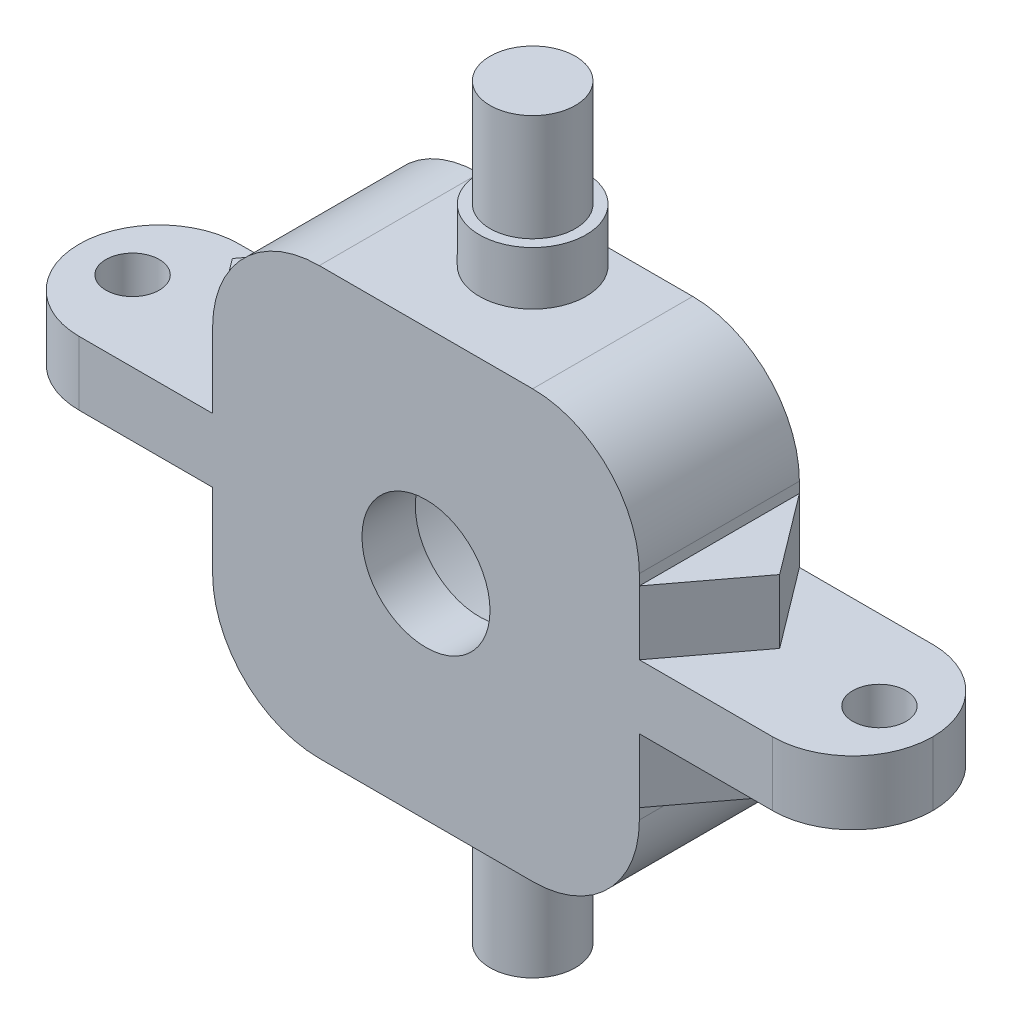
from build123d import *

# Parameters (mm, degrees)
SKETCH1_W           = 40
SKETCH1_H           = 40
SKETCH1_R           = 6
BOSS_EXTRUDE1_DEPTH = 15
SKETCH2_R           = 15
CUT_EXTRUDE1_DEPTH  = 10
SKETCH4_R           = 4
BOSS_EXTRUDE2_DEPTH = 15
SKETCH5_R           = 5
BOSS_EXTRUDE3_DEPTH = 5
BOSS_EXTRUDE4_START = 5
SKETCH7_R           = 5
BOSS_EXTRUDE4_DEPTH = 5
BOSS_EXTRUDE5_START = 10
SKETCH8_R           = 4
BOSS_EXTRUDE5_DEPTH = 10
FILLET1_R           = 10
SKETCH9_W           = 15
SKETCH9_H           = 6
BOSS_EXTRUDE6_DEPTH = 20
SKETCH10_W          = 15
SKETCH10_H          = 6
BOSS_EXTRUDE7_DEPTH = 20
CUT_EXTRUDE2_REACH  = 74.588
SKETCH11_R          = 2.5
FILLET2_R           = 7.5
BOSS_EXTRUDE8_DEPTH = 6
BOSS_EXTRUDE9_DEPTH = 6


with BuildPart() as part:
    # Sketch1 → Boss-Extrude1 (new body)
    with BuildSketch(Plane.XY):
        with Locations((20, 20)):
            Rectangle(SKETCH1_W, SKETCH1_H)
        with Locations((20, 20)):
            Circle(SKETCH1_R, mode=Mode.SUBTRACT)
    extrude(amount=BOSS_EXTRUDE1_DEPTH)

    # Sketch2 → Cut-Extrude1 (cut)
    with BuildSketch(Plane(origin=(0, 0, 0), x_dir=(-1, 0, 0), z_dir=(0, 0, -1))):
        with Locations((-20, 20)):
            Circle(SKETCH2_R)
    extrude(amount=-CUT_EXTRUDE1_DEPTH, mode=Mode.SUBTRACT)

    # Sketch4 → Boss-Extrude2 (add)
    with BuildSketch(Plane(origin=(0, 40, 0), x_dir=(1, 0, 0), z_dir=(0, 1, 0))):
        with Locations((20, -5)):
            Circle(SKETCH4_R)
    extrude(amount=BOSS_EXTRUDE2_DEPTH)

    # Sketch5 → Boss-Extrude3 (add)
    with BuildSketch(Plane(origin=(0, 40, 0), x_dir=(1, 0, 0), z_dir=(0, 1, 0))):
        with Locations(Location((20, -5, 0), (0, 0, 90))):
            Circle(SKETCH5_R)
    extrude(amount=BOSS_EXTRUDE3_DEPTH)

    # Sketch7 → Boss-Extrude4 (add)
    with BuildSketch(Plane.XZ.offset(BOSS_EXTRUDE4_START)):
        with Locations(Location((20, 5, 0), (0, 0, 270))):
            Circle(SKETCH7_R)
    extrude(amount=-BOSS_EXTRUDE4_DEPTH)

    # Sketch8 → Boss-Extrude5 (add)
    with BuildSketch(Plane.XZ.offset(5).offset(BOSS_EXTRUDE5_START)):
        with Locations(Location((20, 5, 0), (0, 0, 180))):
            Circle(SKETCH8_R)
    extrude(amount=-BOSS_EXTRUDE5_DEPTH)

    # Fillet1
    fillet1_edges = [part.edges().sort_by_distance(p)[0] for p in [
        (40, 0, 7.5),
        (0, 0, 7.5),
        (0, 40, 7.5),
        (40, 40, 7.5),
    ]]
    fillet(fillet1_edges, radius=FILLET1_R)

    # Sketch9 → Boss-Extrude6 (add)
    with BuildSketch(Plane(origin=(40, 0, 0), x_dir=(0, 0, -1), z_dir=(1, 0, 0))):
        with Locations((-7.5, 20)):
            Rectangle(SKETCH9_W, SKETCH9_H)
    extrude(amount=BOSS_EXTRUDE6_DEPTH)

    # Sketch10 → Boss-Extrude7 (add)
    with BuildSketch(Plane.ZY):
        with Locations((7.5, 20)):
            Rectangle(SKETCH10_W, SKETCH10_H)
    extrude(amount=BOSS_EXTRUDE7_DEPTH)

    # Sketch11 → Cut-Extrude2 (cut, up to next)
    with BuildSketch(Plane(origin=(0, 23, 0), x_dir=(1, 0, 0), z_dir=(0, 1, 0)), mode=Mode.PRIVATE) as cut_extrude2_sk1:
        with Locations(Location((-15, -7.5, 0), (0, 0, 270))):
            Circle(SKETCH11_R)
    cut_extrude2_tool1 = extrude(cut_extrude2_sk1.sketch, amount=-CUT_EXTRUDE2_REACH, mode=Mode.PRIVATE) & part.part
    # Sketch11 → Cut-Extrude2 (cut, up to next)
    with BuildSketch(Plane(origin=(0, 23, 0), x_dir=(1, 0, 0), z_dir=(0, 1, 0)), mode=Mode.PRIVATE) as cut_extrude2_sk2:
        with Locations(Location((55, -7.5, 0), (0, 0, 270))):
            Circle(SKETCH11_R)
    cut_extrude2_tool2 = extrude(cut_extrude2_sk2.sketch, amount=-CUT_EXTRUDE2_REACH, mode=Mode.PRIVATE) & part.part
    add(cut_extrude2_tool1.solids().sort_by_distance((-15, 23, 7.5))[0], mode=Mode.SUBTRACT)
    add(cut_extrude2_tool2.solids().sort_by_distance((55, 23, 7.5))[0], mode=Mode.SUBTRACT)

    # Fillet2
    fillet2_edges = [part.edges().sort_by_distance(p)[0] for p in [
        (-20, 20, 15),
        (-20, 20, 0),
        (60, 20, 15),
        (60, 20, 0),
    ]]
    fillet(fillet2_edges, radius=FILLET2_R - 0.0001)  # a hair under: the kernel refuses the full size

    # Sketch12 → Boss-Extrude8 (add)
    with BuildSketch(Plane(origin=(0, 23, 0), x_dir=(1, 0, 0), z_dir=(0, 1, 0))):
        Polygon((0, 0), (0, -15), (-5.651655376, -7.5), align=None)
        Polygon((45.651655376, -7.5), (40, -15), (40, 0), align=None)
    extrude(amount=BOSS_EXTRUDE8_DEPTH)

    # Sketch13 → Boss-Extrude9 (add)
    with BuildSketch(Plane.XZ.offset(-17)):
        Polygon((0, 15), (-5.651655376, 7.5), (0, 0), align=None)
        Polygon((40, 15), (45.651655376, 7.5), (40, 0), align=None)
    extrude(amount=BOSS_EXTRUDE9_DEPTH)


solid = part.part
